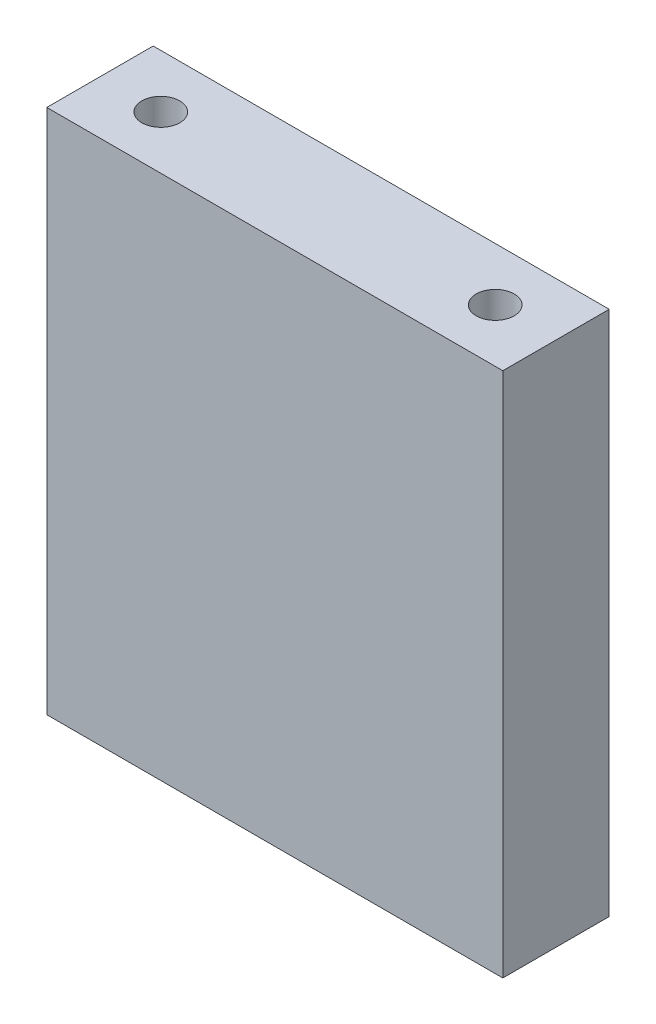
from build123d import *

# Parameters (mm, degrees)
SKETCH_1_W          = 30
SKETCH_1_H          = 34.6
EXTRUDE_1_DEPTH     = 7
SKETCH_2_R          = 1.25
CUT_EXTRUDE_1_DEPTH = 47.326666187


with BuildPart() as part:
    # Эскиз1 → Бобышка-Вытянуть1 (new body)
    with BuildSketch(Plane.XY):
        with Locations((15, 17.3)):
            Rectangle(SKETCH_1_W, SKETCH_1_H)
    extrude(amount=EXTRUDE_1_DEPTH)

    # Эскиз2 → Вырез-Вытянуть1 (cut, through all)
    with BuildSketch(Plane(origin=(0, 34.6, 0), x_dir=(1, 0, 0), z_dir=(0, 1, 0))):
        with Locations((4, -3.5)):
            Circle(SKETCH_2_R)
        with Locations((26, -3.5)):
            Circle(SKETCH_2_R)
    extrude(amount=-CUT_EXTRUDE_1_DEPTH, mode=Mode.SUBTRACT)


solid = part.part
